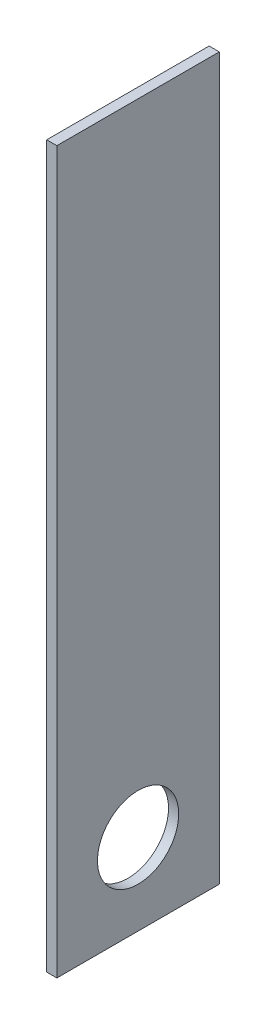
from build123d import *

# Parameters (mm, degrees)
SKETCH1_W           = 50.8
SKETCH1_H           = 225.425
SKETCH1_R           = 12.7
BOSS_EXTRUDE1_DEPTH = 3.175


with BuildPart() as part:
    # Sketch1 → Boss-Extrude1 (new body)
    with BuildSketch(Plane(origin=(0, 0, 0), x_dir=(0, 0, -1), z_dir=(1, 0, 0))):
        Rectangle(SKETCH1_W, SKETCH1_H)
        with Locations((0, -87.3125)):
            Circle(SKETCH1_R, mode=Mode.SUBTRACT)
    extrude(amount=BOSS_EXTRUDE1_DEPTH)


solid = part.part
